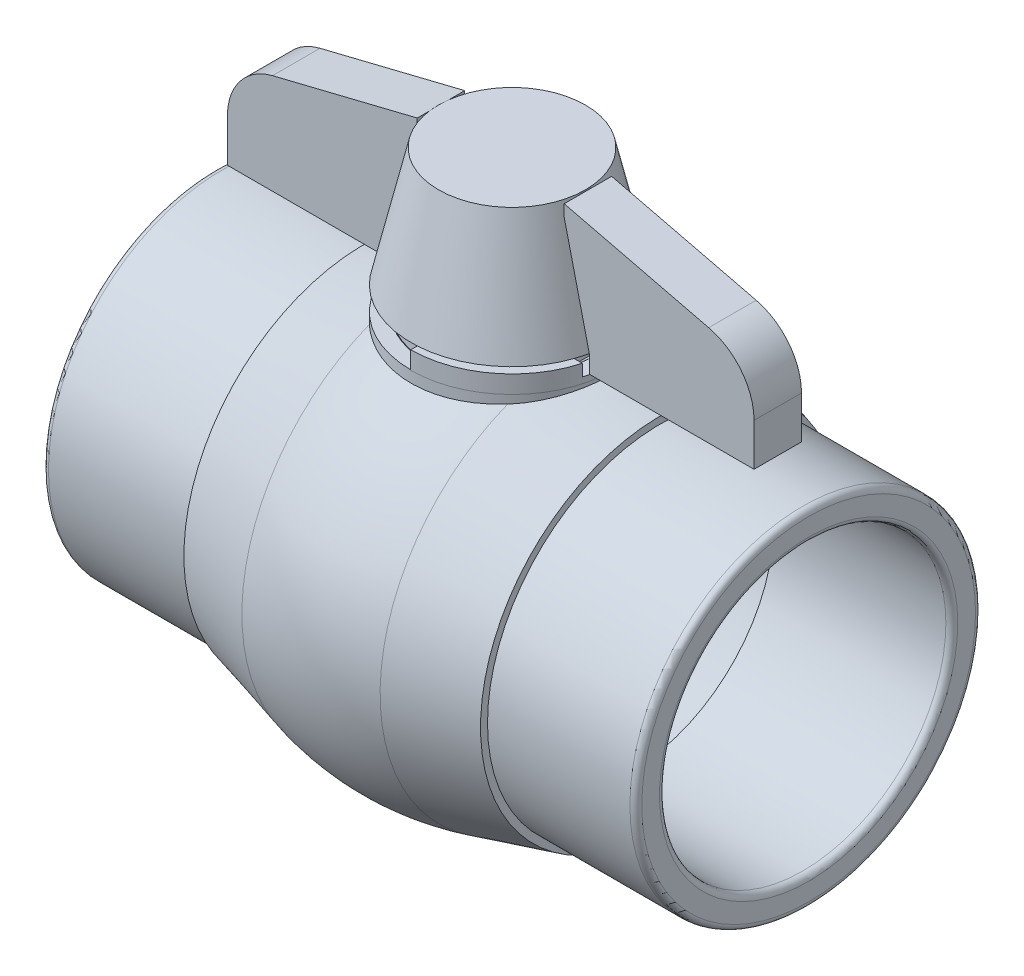
from build123d import *

# Parameters (mm, degrees)
SKETCH2_R                     = 29.13
BOSS_EXTRUDE2_DEPTH           = 50
SHELL2_T                      = -5
FILLET3_R                     = 1
SKETCH3_R                     = 37
BOSS_EXTRUDE3_DEPTH           = 25
BOSS_EXTRUDE3_TAPER           = 15
BOSS_EXTRUDE3_OTHER_WAY_DEPTH = 25
BOSS_EXTRUDE3_OTHER_WAY_TAPER = 15
FILLET4_R                     = 45
SKETCH6_R                     = 17
BOSS_EXTRUDE5_DEPTH           = 10
SKETCH7_R                     = 14.5
CUT_EXTRUDE2_DEPTH            = 30
BOSS_EXTRUDE6_DEPTH           = 3
SKETCH9_R                     = 24.13
BOSS_EXTRUDE8_DEPTH           = 15
SHELL7_T                      = -2
SKETCH10_R                    = 14.5
CUT_EXTRUDE4_DEPTH            = 10
SKETCH11_R                    = 14.4
BOSS_EXTRUDE9_DEPTH           = 4
SKETCH12_R                    = 17
BOSS_EXTRUDE10_DEPTH          = 20
BOSS_EXTRUDE10_TAPER          = 13
SKETCH13_W                    = 32
SKETCH13_H                    = 23
BOSS_EXTRUDE11_DEPTH          = 4
CUT_EXTRUDE5_DEPTH            = 18
CUT_EXTRUDE7_DEPTH            = 18
FILLET8_R                     = 10
FILLET9_R                     = 10
SKETCH16_W                    = 2.671191139
SKETCH16_H                    = 3
CUT_EXTRUDE8_DEPTH            = 5
SKETCH17_W                    = 2.74179478
SKETCH17_H                    = 3
CUT_EXTRUDE13_DEPTH           = 1
SKETCH18_W                    = 2.74179478
SKETCH18_H                    = 3
CUT_EXTRUDE14_DEPTH           = 3


# Read off the part's stored shape, not the designer's step: Shell3
with BuildPart() as part:
    # Sketch2 → Boss-Extrude2 (new, symmetric)
    with BuildSketch(Plane(origin=(0, 0, 0), x_dir=(0, 0, -1), z_dir=(1, 0, 0))):
        with Locations(Location((-55.412558226, 0, 0), (0, 0, 180))):
            Circle(SKETCH2_R)
    extrude(amount=BOSS_EXTRUDE2_DEPTH, both=True)

    # Shell2
    shell2_openings = [part.faces().sort_by_distance(p)[0] for p in [
        (50, 0, 55.412558226),
        (-50, 0, 55.412558226),
    ]]
    offset(amount=SHELL2_T, openings=shell2_openings, kind=Kind.INTERSECTION)

    # Fillet3
    fillet3_edges = [part.edges().sort_by_distance(p)[0] for p in [
        (-50, 0, 26.282558226),
        (50, 0, 26.282558226),
        (-50, 0, 31.282558226),
        (50, 0, 31.282558226),
    ]]
    fillet(fillet3_edges, radius=FILLET3_R)

    # Sketch3 → Boss-Extrude3 (add)
    with BuildSketch(Plane(origin=(0, 0, 0), x_dir=(0, 0, -1), z_dir=(1, 0, 0))):
        with Locations((-55.412558226, 0)):
            Circle(SKETCH3_R)
    extrude(amount=BOSS_EXTRUDE3_DEPTH, taper=BOSS_EXTRUDE3_TAPER)

    # Sketch3 → Boss-Extrude3 other way (add)
    with BuildSketch(Plane(origin=(0, 0, 0), x_dir=(0, 0, -1), z_dir=(1, 0, 0))):
        with Locations((-55.412558226, 0)):
            Circle(SKETCH3_R)
    extrude(amount=-BOSS_EXTRUDE3_OTHER_WAY_DEPTH, taper=BOSS_EXTRUDE3_OTHER_WAY_TAPER)

    # Fillet4
    fillet4_edges = [part.edges().sort_by_distance(p)[0] for p in [
        (0, 0, 92.412558226),
    ]]
    fillet(fillet4_edges, radius=FILLET4_R)

    # Shell3 outline → Shell3 (revolve, cut)
    with BuildSketch(Plane.YX.offset(-55.412558226)):
        with BuildLine():
            Line((26.464635249, 20), (24.13, 20))
            Line((24.13, 20), (24.13, 25))
            Line((24.13, 25), (0, 25))
            Line((0, 25), (0, -25))
            Line((0, -25), (24.13, -25))
            Line((24.13, -25), (24.13, -20))
            Line((24.13, -20), (26.464635249, -20))
            Line((26.464635249, -20), (29.049604933, -10.352761804))
            ThreePointArc((29.049604933, -10.352761804), (30.412571882, 0), (29.049604933, 10.352761804))
            Line((29.049604933, 10.352761804), (26.464635249, 20))
        make_face()
    revolve(axis=Axis((0, 0, 55.412558226), (1, 0, 0)), mode=Mode.SUBTRACT)

    # Sketch6 → Boss-Extrude5 (add)
    with BuildSketch(Plane(origin=(0, 23, 0), x_dir=(1, 0, 0), z_dir=(0, 1, 0))):
        with Locations(Location((0, -55.412558226, 0), (0, 0, 127.516219391))):
            Circle(SKETCH6_R)
    extrude(amount=BOSS_EXTRUDE5_DEPTH)

    # Sketch7 → Cut-Extrude2 (cut)
    with BuildSketch(Plane(origin=(0, 33, 0), x_dir=(1, 0, 0), z_dir=(0, 1, 0))):
        with Locations(Location((0, -55.412558226, 0), (0, 0, 270))):
            Circle(SKETCH7_R)
    extrude(amount=-CUT_EXTRUDE2_DEPTH, mode=Mode.SUBTRACT)

    # Sketch8 → Boss-Extrude6 (add)
    with BuildSketch(Plane(origin=(0, 33, 0), x_dir=(1, 0, 0), z_dir=(0, 1, 0))):
        with BuildLine():
            Line((0, -72.481578408), (0, -69.800258493))
            ThreePointArc((0, -69.800258493), (10.255750471, -65.662490062), (14.407911674, -55.412558226))
            Line((14.407911674, -55.412558226), (17.069020181, -55.412558226))
            ThreePointArc((17.069020181, -55.412558226), (12.069619918, -67.482178145), (0, -72.481578408))
        make_face()
    extrude(amount=BOSS_EXTRUDE6_DEPTH)

    # Sketch11 → Boss-Extrude9 (add)
    with BuildSketch(Plane(origin=(0, 33, 0), x_dir=(1, 0, 0), z_dir=(0, 1, 0))):
        with Locations(Location((0, -55.412558226, 0), (0, 0, 270))):
            Circle(SKETCH11_R)
    extrude(amount=BOSS_EXTRUDE9_DEPTH)

    # Sketch12 → Boss-Extrude10 (add)
    with BuildSketch(Plane(origin=(0, 37, 0), x_dir=(1, 0, 0), z_dir=(0, 1, 0))):
        with Locations(Location((0, -55.412558226, 0), (0, 0, 127.516219391))):
            Circle(SKETCH12_R)
    extrude(amount=BOSS_EXTRUDE10_DEPTH, taper=BOSS_EXTRUDE10_TAPER)

    # Sketch13 → Boss-Extrude11 (add, symmetric)
    with BuildSketch(Plane.XY.offset(55)):
        with Locations((-28.382636177, 45.5)):
            Rectangle(SKETCH13_W, SKETCH13_H)
        with Locations((28.382636177, 45.5)):
            Rectangle(SKETCH13_W, SKETCH13_H)
    extrude(amount=BOSS_EXTRUDE11_DEPTH, both=True)

    # Sketch14 → Cut-Extrude5 (cut)
    with BuildSketch(Plane.XY.offset(59)):
        Polygon((-12.382636177, 56.891438933), (-44.382636177, 49), (-44.382636177, 57), (-12.382636177, 57), align=None)
    extrude(amount=-CUT_EXTRUDE5_DEPTH, mode=Mode.SUBTRACT)

    # Sketch15 → Cut-Extrude7 (cut)
    with BuildSketch(Plane.XY.offset(59)):
        Polygon((12.382636177, 56.761412771), (44.382636177, 49), (44.382636177, 57), (12.382636177, 57), align=None)
    extrude(amount=-CUT_EXTRUDE7_DEPTH, mode=Mode.SUBTRACT)

    # Fillet8
    fillet8_edges = [part.edges().sort_by_distance(p)[0] for p in [
        (44.382636177, 49, 55),
    ]]
    fillet(fillet8_edges, radius=FILLET8_R)

    # Fillet9
    fillet9_edges = [part.edges().sort_by_distance(p)[0] for p in [
        (-44.382636177, 49, 55),
    ]]
    fillet(fillet9_edges, radius=FILLET9_R)

    # Sketch16 → Cut-Extrude8 (cut)
    with BuildSketch(Plane.XY.offset(59)):
        with Locations((-15.281572105, 35.5)):
            Rectangle(SKETCH16_W, SKETCH16_H)
    extrude(amount=-CUT_EXTRUDE8_DEPTH, mode=Mode.SUBTRACT)

    # Sketch17 → Cut-Extrude13 (cut, symmetric)
    with BuildSketch(Plane.XY.offset(59)):
        with Locations((15.316873925, 35.5)):
            Rectangle(SKETCH17_W, SKETCH17_H)
    extrude(amount=CUT_EXTRUDE13_DEPTH, both=True, mode=Mode.SUBTRACT)

    # Sketch18 → Cut-Extrude14 (cut)
    with BuildSketch(Plane.XY.offset(58)):
        with Locations((15.316873925, 35.5)):
            Rectangle(SKETCH18_W, SKETCH18_H)
    extrude(amount=-CUT_EXTRUDE14_DEPTH, mode=Mode.SUBTRACT)


with BuildPart() as body_2:
    # Sketch9 → Boss-Extrude8 (new, symmetric)
    with BuildSketch(Plane(origin=(0, 0, 0), x_dir=(0, 0, -1), z_dir=(1, 0, 0))):
        with Locations((-55.412558226, 0)):
            Circle(SKETCH9_R)
    extrude(amount=BOSS_EXTRUDE8_DEPTH, both=True)

    # Shell7
    shell7_openings = [body_2.faces().sort_by_distance(p)[0] for p in [
        (15, 0, 55.412558226),
        (-15, 0, 55.412558226),
    ]]
    offset(amount=SHELL7_T, openings=shell7_openings, kind=Kind.INTERSECTION)

    # Sketch10 → Cut-Extrude4 (cut)
    with BuildSketch(Plane(origin=(0, 23, 0), x_dir=(1, 0, 0), z_dir=(0, 1, 0))):
        with Locations(Location((0, -55.412558226, 0), (0, 0, 270))):
            Circle(SKETCH10_R)
    extrude(amount=-CUT_EXTRUDE4_DEPTH, mode=Mode.SUBTRACT)


solid = Compound([part.part, body_2.part])
